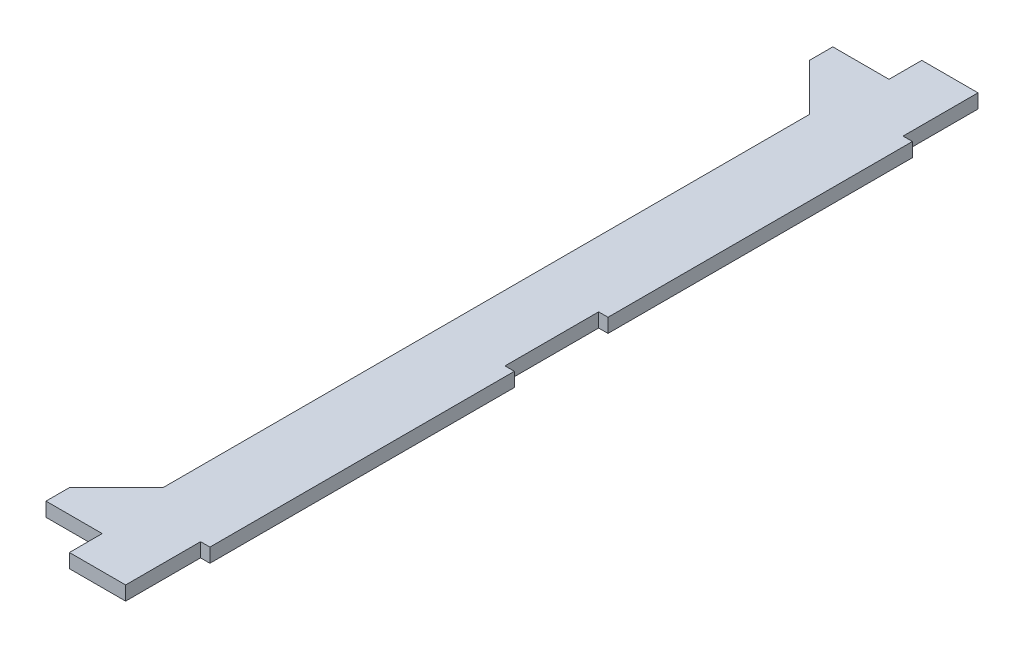
from build123d import *

# Parameters (mm, degrees)
DODANIE_WYCI_GNI_CIE1_DEPTH = 3


with BuildPart() as part:
    # Szkic1 → Dodanie-wyciągnięcie1 (new body)
    with BuildSketch(Plane(origin=(0, 0, 0), x_dir=(1, 0, 0), z_dir=(0, 1, 0))):
        Polygon((452.848319637, -47.862139829), (450.848319637, -47.862139829), (450.848319637, -63.862139829), (438.848319637, -63.862139829), (438.848319637, -56.862139829), (426.848319637, -56.862139829), (426.848319637, -51.862139829), (436.848319637, -41.862139829), (436.848319637, 27.137860171), (436.848319637, 96.137860171), (426.848319637, 106.137860171), (426.848319637, 111.137860171), (438.848319637, 111.137860171), (438.848319637, 118.137860171), (450.848319637, 118.137860171), (450.848319637, 102.137860171), (452.848319637, 102.137860171), (452.848319637, 37.137860171), (450.848319637, 37.137860171), (450.848319637, 27.137860171), (450.848319637, 17.137860171), (452.848319637, 17.137860171), align=None)
    extrude(amount=DODANIE_WYCI_GNI_CIE1_DEPTH)


solid = part.part
